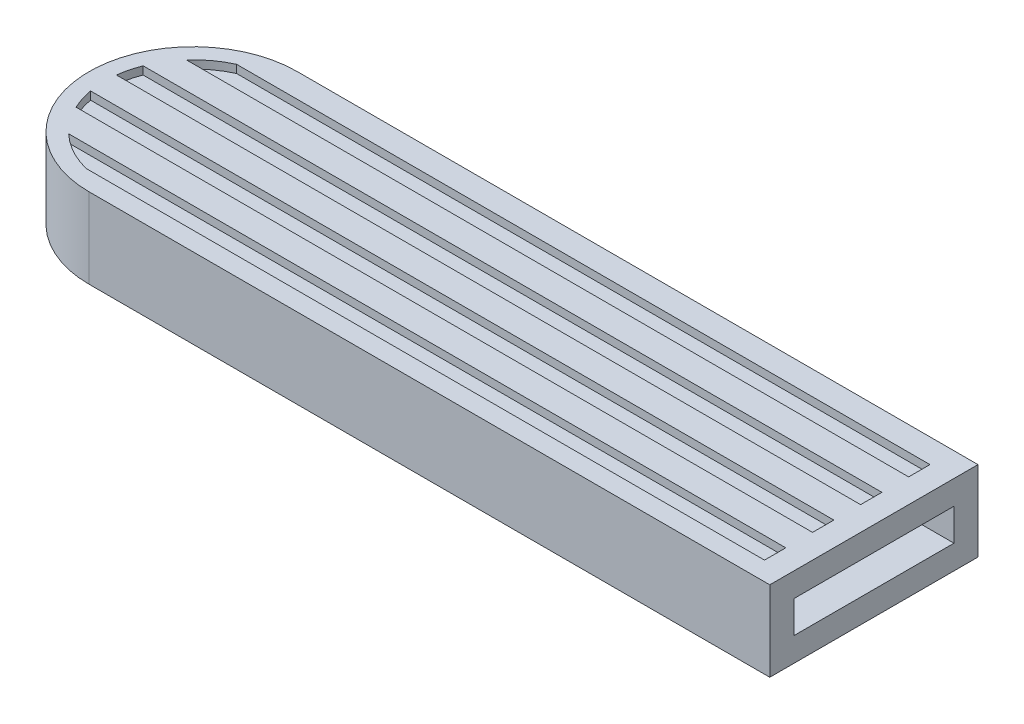
from build123d import *

# Parameters (mm, degrees)
SWEEP_THIN1_START              = -85
SWEEP_THIN1_OUTLINE_W          = 10
SWEEP_THIN1_OUTLINE_H          = 26
SWEEP_THIN1_OUTLINE_W_2        = 4
SWEEP_THIN1_OUTLINE_H_2        = 20
SWEEP_THIN1_DEPTH              = 85
BOSS_EXTRUDE1_DEPTH            = 10
CUT_EXTRUDE1_DEPTH             = 1
SKETCH7_R                      = 6
SKETCH7_R_2                    = 4
BOSS_EXTRUDE2_DEPTH            = 1
CUT_EXTRUDE2_REACH             = 101.363
SKETCH8_R                      = 3.991679888
CUT_EXTRUDE2_DIRECTION_2_DEPTH = 100.36297097


# Read off the part's stored shape, not the designer's step: Sweep-Thin1
with BuildPart() as part:
    # Sweep-Thin1 outline → Sweep-Thin1 (new body)
    with BuildSketch(Plane.YZ.offset(SWEEP_THIN1_START)):
        Rectangle(SWEEP_THIN1_OUTLINE_W, SWEEP_THIN1_OUTLINE_H)
        Rectangle(SWEEP_THIN1_OUTLINE_W_2, SWEEP_THIN1_OUTLINE_H_2, mode=Mode.SUBTRACT)
    extrude(amount=SWEEP_THIN1_DEPTH)

    # Sketch5 → Boss-Extrude1 (add)
    with BuildSketch(Plane(origin=(0, 5, 0), x_dir=(1, 0, 0), z_dir=(0, 1, 0))):
        with BuildLine():
            Line((-85, -13), (-85, 13))
            ThreePointArc((-85, 13), (-98, 0), (-85, -13))
        make_face()
    extrude(amount=-BOSS_EXTRUDE1_DEPTH)

    # Sketch6 → Cut-Extrude1 (cut)
    with BuildSketch(Plane(origin=(0, 5, 0), x_dir=(1, 0, 0), z_dir=(0, 1, 0))):
        with BuildLine():
            Line((-89.582575695, 10), (-3, 10))
            Line((-3, 10), (-3, 7.339674458))
            Line((-3, 7.339674458), (-93.193239827, 7.339674458))
            ThreePointArc((-93.193239827, 7.339674458), (-91.524929008, 8.855806086), (-89.582575695, 10))
        make_face()
        with BuildLine():
            Line((-95.246950766, 4), (-3, 4))
            Line((-3, 4), (-3, 1.339674458))
            Line((-3, 1.339674458), (-95.918116703, 1.339674458))
            ThreePointArc((-95.918116703, 1.339674458), (-95.665802982, 2.690844989), (-95.246950766, 4))
        make_face()
        with BuildLine():
            Line((-95.816653826, -2), (-3, -2))
            Line((-3, -2), (-3, -4.660325542))
            Line((-3, -4.660325542), (-94.964003505, -4.660325542))
            ThreePointArc((-94.964003505, -4.660325542), (-95.475125907, -3.357340797), (-95.816653826, -2))
        make_face()
        with BuildLine():
            Line((-92.549834435, -8), (-3, -8))
            Line((-3, -8), (-3, -10.660325542))
            Line((-3, -10.660325542), (-87.712463701, -10.660325542))
            ThreePointArc((-87.712463701, -10.660325542), (-90.300756904, -9.638567126), (-92.549834435, -8))
        make_face()
    cut_extrude1 = extrude(amount=-CUT_EXTRUDE1_DEPTH, mode=Mode.SUBTRACT)

    # Mirror1: Cut-Extrude1 across plane
    add(cut_extrude1.mirror(Plane.ZX), mode=Mode.SUBTRACT)

    # Sketch7 → Boss-Extrude2 (add)
    with BuildSketch(Plane.XZ.offset(5)):
        with Locations((-16, 0)):
            Circle(SKETCH7_R)
        with Locations((-16, 0)):
            Circle(SKETCH7_R_2, mode=Mode.SUBTRACT)
    extrude(amount=-BOSS_EXTRUDE2_DEPTH)

    # Sketch8 → Cut-Extrude2 (cut, up to next)
    with BuildSketch(Plane(origin=(0, -5, 0), x_dir=(-1, 0, 0), z_dir=(0, -1, 0)), mode=Mode.PRIVATE) as cut_extrude2_sk1:
        with Locations(Location((16.005403819, 0.006326373, 0), (0, 0, 270))):
            Circle(SKETCH8_R)
    cut_extrude2_tool1 = extrude(cut_extrude2_sk1.sketch, amount=-CUT_EXTRUDE2_REACH, mode=Mode.PRIVATE) & part.part
    add(cut_extrude2_tool1.solids().sort_by_distance((-16.005404, -5, -0.006326))[0], mode=Mode.SUBTRACT)

    # Sketch8 → Cut-Extrude2 direction 2 (cut)
    with BuildSketch(Plane(origin=(0, -5, 0), x_dir=(-1, 0, 0), z_dir=(0, -1, 0))):
        with Locations(Location((16.005403819, 0.006326373, 0), (0, 0, 270))):
            Circle(SKETCH8_R)
    extrude(amount=CUT_EXTRUDE2_DIRECTION_2_DEPTH, mode=Mode.SUBTRACT)


solid = part.part
